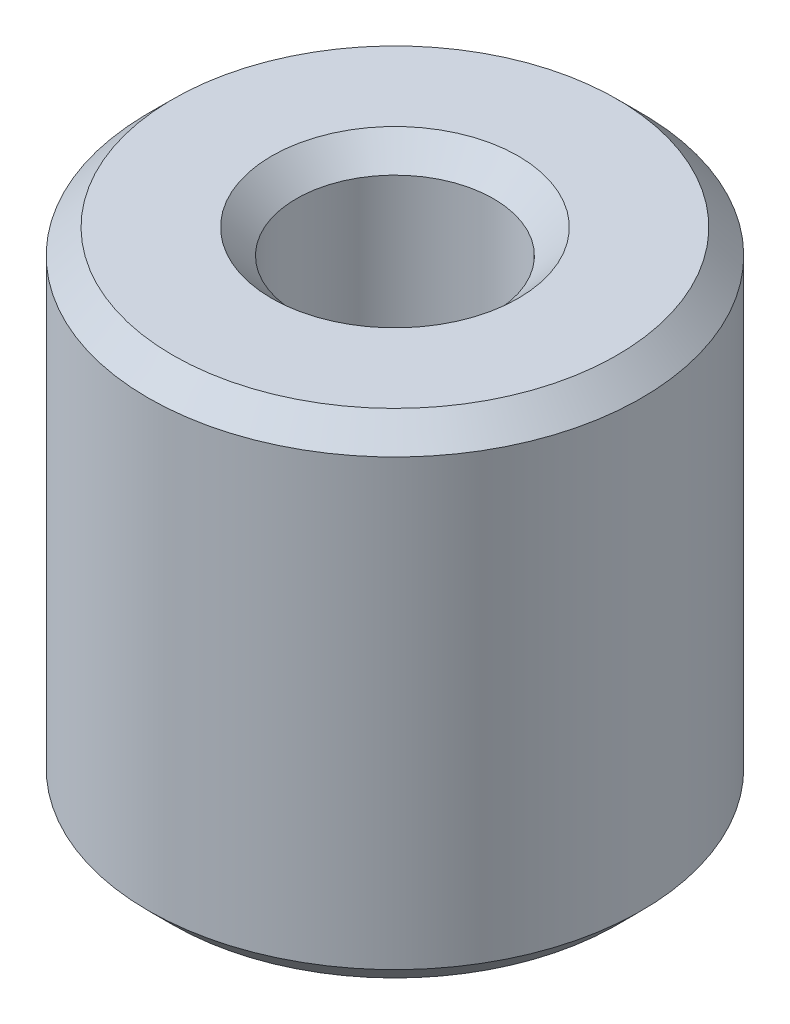
from build123d import *

# Parameters (mm, degrees)
SKETCH1_R           = 4
SKETCH1_R_2         = 1.6
BOSS_EXTRUDE1_DEPTH = 8
CHAMFER1_SIZE       = 0.4


with BuildPart() as part:
    # Sketch1 → Boss-Extrude1 (new body)
    with BuildSketch(Plane(origin=(0, 0, 0), x_dir=(1, 0, 0), z_dir=(0, 1, 0))):
        Circle(SKETCH1_R)
        Circle(SKETCH1_R_2, mode=Mode.SUBTRACT)
    extrude(amount=BOSS_EXTRUDE1_DEPTH)

    # Chamfer1
    chamfer1_edges = [part.edges().sort_by_distance(p)[0] for p in [
        (-1.6, 0, 0),
        (-4, 0, 0),
        (-1.6, 8, 0),
        (-4, 8, 0),
    ]]
    chamfer(chamfer1_edges, length=CHAMFER1_SIZE)


solid = part.part
